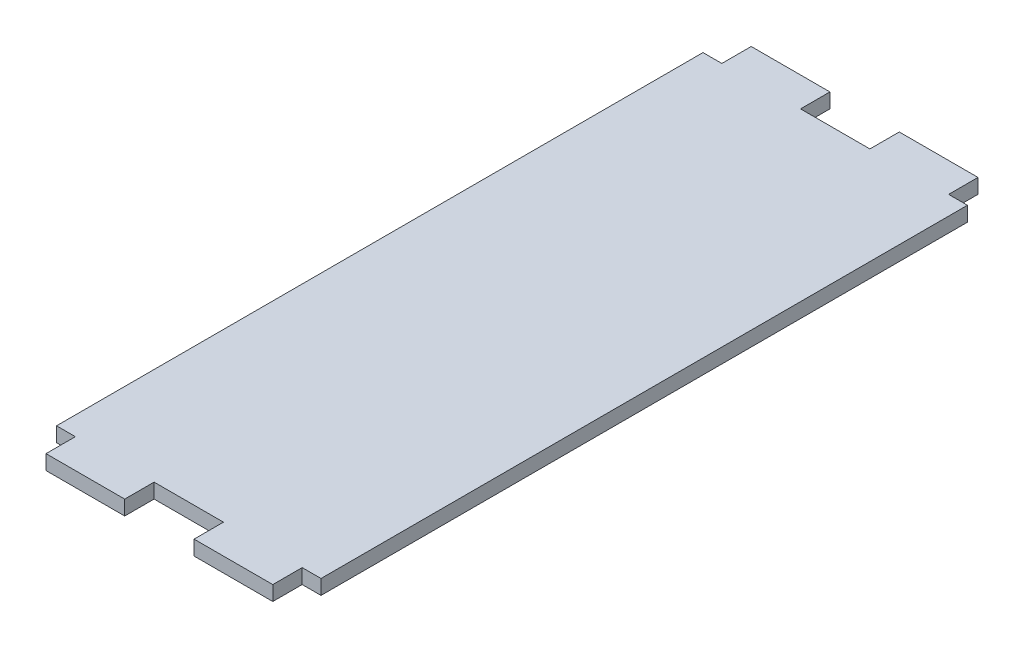
from build123d import *

# Parameters (mm, degrees)
SKETCH1_W           = 57.15
SKETCH1_H           = 152.4
BOSS_EXTRUDE1_DEPTH = 3.175
SKETCH2_W           = 4.07
SKETCH2_H           = 6.35
SKETCH2_W_2         = 14.99
CUT_EXTRUDE1_DEPTH  = 82.443546399


with BuildPart() as part:
    # Sketch1 → Boss-Extrude1 (new body)
    with BuildSketch(Plane(origin=(0, 0, 0), x_dir=(1, 0, 0), z_dir=(0, 1, 0))):
        Rectangle(SKETCH1_W, SKETCH1_H)
    extrude(amount=BOSS_EXTRUDE1_DEPTH)

    # Sketch2 → Cut-Extrude1 (cut, through all)
    with BuildSketch(Plane(origin=(0, 3.175, 0), x_dir=(1, 0, 0), z_dir=(0, 1, 0))):
        with Locations((-26.54, -73.025)):
            Rectangle(SKETCH2_W, SKETCH2_H)
        with Locations((26.54, -73.025)):
            Rectangle(SKETCH2_W, SKETCH2_H)
        with Locations((0, -73.025)):
            Rectangle(SKETCH2_W_2, SKETCH2_H)
    cut_extrude1 = extrude(amount=-CUT_EXTRUDE1_DEPTH, mode=Mode.SUBTRACT)

    # Mirror1: Cut-Extrude1 across plane
    add(cut_extrude1.mirror(Plane.XY), mode=Mode.SUBTRACT)


solid = part.part
